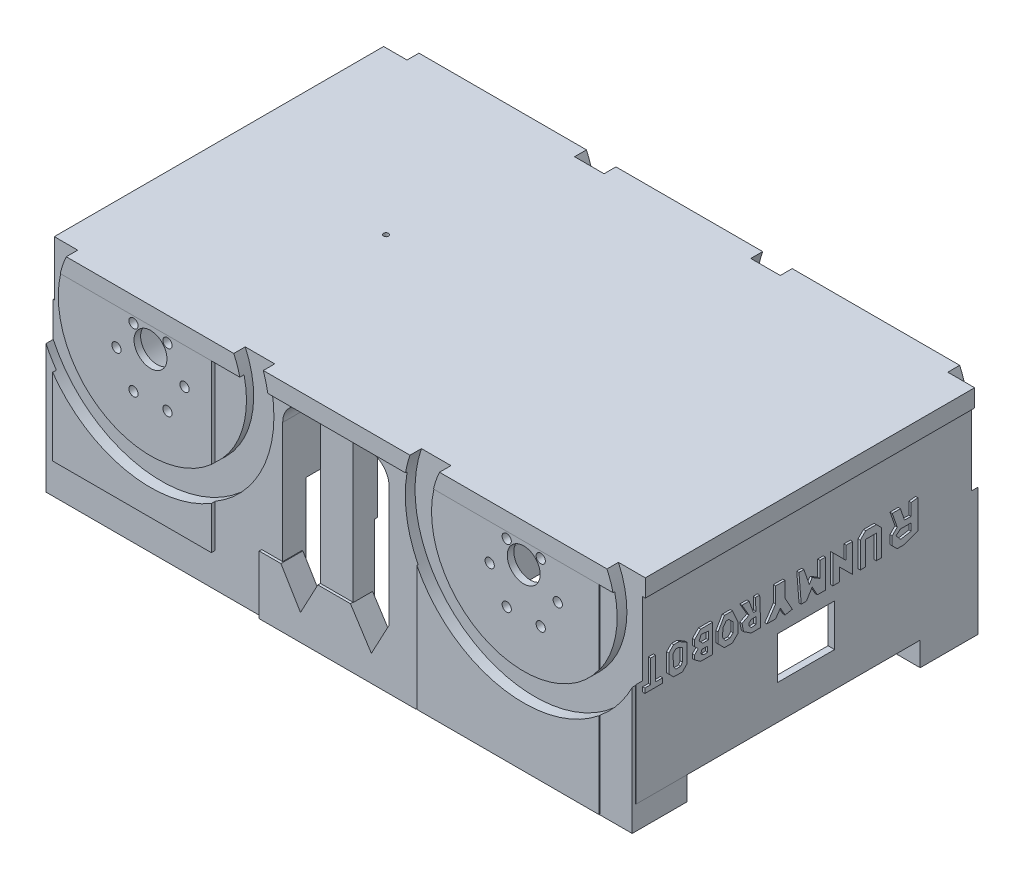
from build123d import *

# Parameters (mm, degrees)
MOTORHOLDERS_DEPTH            = 80
MOTORHOLDERS_DEPTH_BACK       = 80
MOTORHOLDERSSKETCH_R          = 23.41
MOTORHOLDERS_2_DEPTH          = 80
MOTORHOLDERS_2_DEPTH_BACK     = 80
SKETCH4_W                     = 262.774983374
SKETCH4_H                     = 153.112553215
CUT_EXTRUDE1_DEPTH            = 26
POWERBANKHOLDERS_DEPTH        = 40
POWERBANKHOLDERS_DEPTH_BACK   = 59
SKETCH6_W                     = 107.485666349
SKETCH6_H                     = 13.420779118
SKETCH6_W_2                   = 20.810206851
SKETCH6_H_2                   = 2.021058642
POWERBANKHOLDERS_2_DEPTH      = 40
POWERBANKHOLDERS_2_DEPTH_BACK = 59
SKETCH6_W_3                   = 107.81575089
SKETCH6_H_3                   = 38.261259506
SKETCH6_W_4                   = 10.842850571
SKETCH6_H_4                   = 10.347679347
POWERBANKHOLDERS_3_DEPTH      = 40
POWERBANKHOLDERS_3_DEPTH_BACK = 59
SKETCH6_W_5                   = 41.498763714
SKETCH6_H_5                   = 37.111507406
SKETCH6_W_6                   = 12.844328805
SKETCH6_H_6                   = 18.336479725
SKETCH6_W_7                   = 4.801433035
SKETCH6_H_7                   = 16.443461188
POWERBANKHOLDERS_4_DEPTH      = 40
POWERBANKHOLDERS_4_DEPTH_BACK = 59
SKETCH6_W_8                   = 41.763104176
SKETCH6_H_8                   = 35.272094794
SKETCH6_W_9                   = 11.134493861
SKETCH6_H_9                   = 18.035399163
SKETCH6_W_10                  = 4.654088682
SKETCH6_H_10                  = 14.436538778
POWERBANKHOLDERS_5_DEPTH      = 40
POWERBANKHOLDERS_5_DEPTH_BACK = 59
SKETCH6_W_11                  = 17.763333386
SKETCH6_H_11                  = 11.185766025
POWERBANKHOLDERS_6_DEPTH      = 40
POWERBANKHOLDERS_6_DEPTH_BACK = 59
SKETCH6_W_12                  = 14.811929009
SKETCH6_H_12                  = 11.030658464
POWERBANKHOLDERS_7_DEPTH      = 40
POWERBANKHOLDERS_7_DEPTH_BACK = 59
SKETCH6_W_13                  = 28.150495439
SKETCH6_H_13                  = 24.933985152
SKETCH6_W_14                  = 10.177859407
SKETCH6_H_14                  = 9.83070569
POWERBANKHOLDERS_8_DEPTH      = 40
POWERBANKHOLDERS_8_DEPTH_BACK = 59
SKETCH6_W_15                  = 30.670744753
SKETCH6_H_15                  = 26.330219561
SKETCH6_W_16                  = 9.898416255
SKETCH6_H_16                  = 10.635603546
BOTTOMPLATE_DEPTH             = 5
BOTTOMPLATE_DEPTH_BACK        = 3
SKETCH21_R                    = 156.395305675
SKETCH23_W                    = 72.331231332
SKETCH23_H                    = 81.163054316
SKETCH23_W_2                  = 82.936115801
SKETCH23_H_2                  = 96.211163908
MOTORMOUNTINGSUPPORT1_DEPTH   = 6
SKETCH24_W                    = 78.341994801
SKETCH24_H                    = 94.439711356
SKETCH24_W_2                  = 53.914675369
SKETCH24_H_2                  = 86.674739968
MOTORMOUNTINGSUPPOR2_DEPTH    = 6
SKETCH17_R                    = 2.1
SKETCH17_R_2                  = 7.5
MOTORHOLES1_DEPTH             = 31.5
SKETCH19_R                    = 2.1
SKETCH19_R_2                  = 7.5
CUT_EXTRUDE4_DEPTH            = 30
BOLTHOLESSKETCH3_R            = 2.1
BOLTHOLESSKETCH3_R_2          = 7.5
MOTORHOLES3_DEPTH             = 31.5
BOLTHOLESSKETCH4_R            = 2.1
BOLTHOLESSKETCH4_R_2          = 7.5
MOTORHOLES4_DEPTH             = 15
SKETCH29_W                    = 154.635205036
SKETCH29_H                    = 84.131588093
SKETCH29_W_2                  = 26
SKETCH29_H_2                  = 19.212652328
BOSS_EXTRUDE8_DEPTH           = 3
SKETCH27_W                    = 226.46009322
SKETCH27_H                    = 129.985211715
BOSS_EXTRUDE6_DEPTH           = 3
SKETCH40_W                    = 33.841577611
SKETCH40_H                    = 31.531825246
BOSS_EXTRUDE11_DEPTH          = 40
FILLET2_R                     = 15
FILLET3_R                     = 15
POWERBANKCUT_START            = -54.404272
POWERBANKCUT_DEPTH            = 54.404272
MOTORHOLDERCUT_DEPTH          = 77
MOTORHOLDERCUT_DEPTH_BACK     = 77
MOTORHOLDEREXTRUDESKETCH_R    = 20.415
LABEL_DEPTH                   = 1
BASEDEFININGCUT_DEPTH         = 20
BASEDEFININGCUT_DEPTH_BACK    = 20
SKETCH32_W                    = 420.045569038
SKETCH32_H                    = 425.046527557
SKETCH32_W_2                  = 269.205670794
SKETCH32_H_2                  = 160.645125556
SKETCH36_R                    = 7.790164171
CUT_EXTRUDE6_DEPTH            = 40
SKETCH37_W                    = 55.340133611
SKETCH37_H                    = 29.7708905
CUT_EXTRUDE7_DEPTH            = 36
SKETCH38_R                    = 1.145182774
CUT_EXTRUDE8_DEPTH            = 10
SPACEFORWHEEL1_DEPTH          = 10
SPACEFORWHEEL1_DEPTH_BACK     = 5
SKETCH41_R                    = 54.5
SKETCH41_R_2                  = 42
CUT_EXTRUDE10_DEPTH           = 10
CUT_EXTRUDE10_DEPTH_BACK      = 5
SKETCH42_R                    = 54.5
SKETCH42_R_2                  = 42
CUT_EXTRUDE11_DEPTH           = 10
CUT_EXTRUDE11_DEPTH_BACK      = 5
SKETCH43_R                    = 54.5
SKETCH43_R_2                  = 42
CUT_EXTRUDE12_DEPTH           = 10
CUT_EXTRUDE12_DEPTH_BACK      = 5
SKETCH44_R                    = 54.5
SKETCH44_R_2                  = 42
SKETCH45_W                    = 114.137539603
SKETCH45_H                    = 98.697181704
BACKPLATE_DEPTH               = 2
FILLET8_R                     = 10
FILLET9_R                     = 10
FILLET10_R                    = 10
FILLET11_R                    = 10
BOSS_EXTRUDE12_DEPTH          = 10
BOSS_EXTRUDE13_DEPTH          = 9


with BuildPart() as part:
    # MotorHoldersSketch → MotorHolders (new, two sides: drawn at the far end of the back side and taken through both)
    with BuildSketch(Plane.XY.offset(-MOTORHOLDERS_DEPTH_BACK)):
        Circle(MOTORHOLDERSSKETCH_R)
    extrude(amount=MOTORHOLDERS_DEPTH + MOTORHOLDERS_DEPTH_BACK)


with BuildPart() as body_2:
    # MotorHoldersSketch → MotorHolders 2 (new, two sides: drawn at the far end of the back side and taken through both)
    with BuildSketch(Plane.XY.offset(-MOTORHOLDERS_2_DEPTH_BACK)):
        with Locations((170, 0)):
            Circle(MOTORHOLDERSSKETCH_R)
    extrude(amount=MOTORHOLDERS_2_DEPTH + MOTORHOLDERS_2_DEPTH_BACK)


with BuildPart() as cut_extrude1_tool:
    # Sketch4 → Cut-Extrude1 (new body)
    with BuildSketch(Plane(origin=(0, 0, 0), x_dir=(1, 0, 0), z_dir=(0, 1, 0))):
        with Locations((89.893628689, 0.176832173)):
            Rectangle(SKETCH4_W, SKETCH4_H)
    extrude(amount=-CUT_EXTRUDE1_DEPTH)


with BuildPart() as part_1:
    add(part.part)

    # Cut-Extrude1: cut by cut_extrude1_tool
    add(cut_extrude1_tool.part, mode=Mode.SUBTRACT)


with BuildPart() as body_2_1:
    add(body_2.part)

    # Cut-Extrude1: cut by cut_extrude1_tool
    add(cut_extrude1_tool.part, mode=Mode.SUBTRACT)


with BuildPart() as body_3:
    # Sketch6 → PowerBankHolders (new, two sides: drawn at the far end of the back side and taken through both)
    with BuildSketch(Plane(origin=(170, -34.829272125, 0), x_dir=(-1, 0, 0), z_dir=(0, -1, 0)).offset(-POWERBANKHOLDERS_DEPTH_BACK)):
        with Locations((165.843013364, 72.238602394)):
            Rectangle(SKETCH6_W, SKETCH6_H)
        with Locations((203.359863582, 72.025840015)):
            Rectangle(SKETCH6_W_2, SKETCH6_H_2, mode=Mode.SUBTRACT)
    extrude(amount=POWERBANKHOLDERS_DEPTH + POWERBANKHOLDERS_DEPTH_BACK)



with BuildPart() as body_4:
    # Sketch6 → PowerBankHolders 2 (new, two sides: drawn at the far end of the back side and taken through both)
    with BuildSketch(Plane(origin=(170, -34.829272125, 0), x_dir=(-1, 0, 0), z_dir=(0, -1, 0)).offset(-POWERBANKHOLDERS_2_DEPTH_BACK)):
        with Locations((165.406852056, -59.151522269)):
            Rectangle(SKETCH6_W_3, SKETCH6_H_3)
        with Locations((206.519672379, -65.314281269)):
            Rectangle(SKETCH6_W_4, SKETCH6_H_4, mode=Mode.SUBTRACT)
    extrude(amount=POWERBANKHOLDERS_2_DEPTH + POWERBANKHOLDERS_2_DEPTH_BACK)


with BuildPart() as body_5:
    # Sketch6 → PowerBankHolders 3 (new, two sides: drawn at the far end of the back side and taken through both)
    with BuildSketch(Plane(origin=(170, -34.829272125, 0), x_dir=(-1, 0, 0), z_dir=(0, -1, 0)).offset(-POWERBANKHOLDERS_3_DEPTH_BACK)):
        with Locations((40.739743063, 59.306920349)):
            Rectangle(SKETCH6_W_5, SKETCH6_H_5)
        with Locations((34.93306737, 60.00949088)):
            Rectangle(SKETCH6_W_6, SKETCH6_H_6, mode=Mode.SUBTRACT)
        with Locations((56.270377412, 59.541495334)):
            Rectangle(SKETCH6_W_7, SKETCH6_H_7, mode=Mode.SUBTRACT)
    extrude(amount=POWERBANKHOLDERS_3_DEPTH + POWERBANKHOLDERS_3_DEPTH_BACK)


with BuildPart() as body_6:
    # Sketch6 → PowerBankHolders 4 (new, two sides: drawn at the far end of the back side and taken through both)
    with BuildSketch(Plane(origin=(170, -34.829272125, 0), x_dir=(-1, 0, 0), z_dir=(0, -1, 0)).offset(-POWERBANKHOLDERS_4_DEPTH_BACK)):
        with Locations((40.966801585, -61.807610384)):
            Rectangle(SKETCH6_W_8, SKETCH6_H_8)
        with Locations((37.73953158, -63.792391966)):
            Rectangle(SKETCH6_W_9, SKETCH6_H_9, mode=Mode.SUBTRACT)
        with Locations((54.037759341, -62.645522509)):
            Rectangle(SKETCH6_W_10, SKETCH6_H_10, mode=Mode.SUBTRACT)
    extrude(amount=POWERBANKHOLDERS_4_DEPTH + POWERBANKHOLDERS_4_DEPTH_BACK)


with BuildPart() as body_7:
    # Sketch6 → PowerBankHolders 5 (new, two sides: drawn at the far end of the back side and taken through both)
    with BuildSketch(Plane(origin=(170, -34.829272125, 0), x_dir=(-1, 0, 0), z_dir=(0, -1, 0)).offset(-POWERBANKHOLDERS_5_DEPTH_BACK)):
        with Locations((88.297855443, 73.356108941)):
            Rectangle(SKETCH6_W_11, SKETCH6_H_11)
    extrude(amount=POWERBANKHOLDERS_5_DEPTH + POWERBANKHOLDERS_5_DEPTH_BACK)


with BuildPart() as body_8:
    # Sketch6 → PowerBankHolders 6 (new, two sides: drawn at the far end of the back side and taken through both)
    with BuildSketch(Plane(origin=(170, -34.829272125, 0), x_dir=(-1, 0, 0), z_dir=(0, -1, 0)).offset(-POWERBANKHOLDERS_6_DEPTH_BACK)):
        with Locations((86.822153254, -72.76682279)):
            Rectangle(SKETCH6_W_12, SKETCH6_H_12)
    extrude(amount=POWERBANKHOLDERS_6_DEPTH + POWERBANKHOLDERS_6_DEPTH_BACK)


with BuildPart() as body_9:
    # Sketch6 → PowerBankHolders 7 (new, two sides: drawn at the far end of the back side and taken through both)
    with BuildSketch(Plane(origin=(170, -34.829272125, 0), x_dir=(-1, 0, 0), z_dir=(0, -1, 0)).offset(-POWERBANKHOLDERS_7_DEPTH_BACK)):
        with Locations((-34.775388772, -66.976665205)):
            Rectangle(SKETCH6_W_13, SKETCH6_H_13)
        with Locations((-36.725173705, -67.894738702)):
            Rectangle(SKETCH6_W_14, SKETCH6_H_14, mode=Mode.SUBTRACT)
    extrude(amount=POWERBANKHOLDERS_7_DEPTH + POWERBANKHOLDERS_7_DEPTH_BACK)


with BuildPart() as body_10:
    # Sketch6 → PowerBankHolders 8 (new, two sides: drawn at the far end of the back side and taken through both)
    with BuildSketch(Plane(origin=(170, -34.829272125, 0), x_dir=(-1, 0, 0), z_dir=(0, -1, 0)).offset(-POWERBANKHOLDERS_8_DEPTH_BACK)):
        with Locations((-33.722690809, 64.697564271)):
            Rectangle(SKETCH6_W_15, SKETCH6_H_15)
        with Locations((-36.585452129, 63.859928969)):
            Rectangle(SKETCH6_W_16, SKETCH6_H_16, mode=Mode.SUBTRACT)
    extrude(amount=POWERBANKHOLDERS_8_DEPTH + POWERBANKHOLDERS_8_DEPTH_BACK)


with BuildPart() as body_3_1:
    add(body_3.part)

    add(body_4.part)  # BottomPlate merges body 4

    add(body_2_1.part)  # BottomPlate merges body 2

    add(part_1.part)  # BottomPlate merges part

    add(body_5.part)  # BottomPlate merges body 5

    add(body_6.part)  # BottomPlate merges body 6
    # Sketch21 → BottomPlate (add, two sides: drawn at the far end of the back side and taken through both)
    with BuildSketch(Plane(origin=(0, 19.575, 0), x_dir=(1, 0, 0), z_dir=(0, 1, 0)).offset(-BOTTOMPLATE_DEPTH_BACK)):
        with Locations(Location((85, 0, 0), (0, 0, 270))):
            Circle(SKETCH21_R)
    extrude(amount=BOTTOMPLATE_DEPTH + BOTTOMPLATE_DEPTH_BACK)


    add(body_9.part)  # MotorMountingSupport1 merges body 9
    # Sketch23 → MotorMountingSupport1 (add)
    with BuildSketch(Plane.XY.offset(80)):
        with Locations((-8.424510745, -18.741332274)):
            Rectangle(SKETCH23_W, SKETCH23_H)
        with Locations((162.789906406, -26.26538707)):
            Rectangle(SKETCH23_W_2, SKETCH23_H_2)
    extrude(amount=-MOTORMOUNTINGSUPPORT1_DEPTH)


    add(body_10.part)  # MotorMountingSuppor2 merges body 10
    # Sketch24 → MotorMountingSuppor2 (add)
    with BuildSketch(Plane(origin=(0, 0, -80), x_dir=(-1, 0, 0), z_dir=(0, 0, -1))):
        with Locations((-163.019522912, -27.982448794)):
            Rectangle(SKETCH24_W, SKETCH24_H)
        with Locations((2.593149567, -20.814772641)):
            Rectangle(SKETCH24_W_2, SKETCH24_H_2)
    extrude(amount=-MOTORMOUNTINGSUPPOR2_DEPTH)

    # Sketch17 → MotorHoles1 (cut)
    with BuildSketch(Plane.XY.offset(80)):
        with Locations((185.5, 0)):
            Circle(SKETCH17_R)
        with Locations((177.75, -13.42)):
            Circle(SKETCH17_R)
        with Locations((162.25, -13.42)):
            Circle(SKETCH17_R)
        with Locations((154.5, 0)):
            Circle(SKETCH17_R)
        with Locations((162.25, 13.42)):
            Circle(SKETCH17_R)
        with Locations((177.75, 13.42)):
            Circle(SKETCH17_R)
        with Locations((170, 7)):
            Circle(SKETCH17_R_2)
    extrude(amount=-MOTORHOLES1_DEPTH, mode=Mode.SUBTRACT)

    # Sketch19 → Cut-Extrude4 (cut)
    with BuildSketch(Plane(origin=(0, 0, -80), x_dir=(-1, 0, 0), z_dir=(0, 0, -1))):
        with Locations(Location((-185.5, 0, 0), (0, 0, 180))):
            Circle(SKETCH19_R)
        with Locations(Location((-177.75, -13.42, 0), (0, 0, 180))):
            Circle(SKETCH19_R)
        with Locations(Location((-162.25, -13.42, 0), (0, 0, 180))):
            Circle(SKETCH19_R)
        with Locations(Location((-154.5, 0, 0), (0, 0, 180))):
            Circle(SKETCH19_R)
        with Locations(Location((-162.25, 13.42, 0), (0, 0, 180))):
            Circle(SKETCH19_R)
        with Locations(Location((-177.75, 13.42, 0), (0, 0, 180))):
            Circle(SKETCH19_R)
        with Locations(Location((-170, 7, 0), (0, 0, 180))):
            Circle(SKETCH19_R_2)
    extrude(amount=-CUT_EXTRUDE4_DEPTH, mode=Mode.SUBTRACT)

    # BoltHolesSketch3 → MotorHoles3 (cut)
    with BuildSketch(Plane.XY.offset(80)):
        with Locations((7.75, -13.42)):
            Circle(BOLTHOLESSKETCH3_R)
        with Locations((15.5, 0)):
            Circle(BOLTHOLESSKETCH3_R)
        with Locations((7.75, 13.42)):
            Circle(BOLTHOLESSKETCH3_R)
        with Locations((-7.75, 13.42)):
            Circle(BOLTHOLESSKETCH3_R)
        with Locations((-15.5, 0)):
            Circle(BOLTHOLESSKETCH3_R)
        with Locations((-7.75, -13.42)):
            Circle(BOLTHOLESSKETCH3_R)
        with Locations((0, 7)):
            Circle(BOLTHOLESSKETCH3_R_2)
    extrude(amount=-MOTORHOLES3_DEPTH, mode=Mode.SUBTRACT)

    # BoltHolesSketch4 → MotorHoles4 (cut)
    with BuildSketch(Plane(origin=(0, 0, -80), x_dir=(-1, 0, 0), z_dir=(0, 0, -1))):
        with Locations(Location((-15.5, 0, 0), (0, 0, 180))):
            Circle(BOLTHOLESSKETCH4_R)
        with Locations(Location((-7.75, 13.42, 0), (0, 0, 180))):
            Circle(BOLTHOLESSKETCH4_R)
        with Locations(Location((7.75, 13.42, 0), (0, 0, 180))):
            Circle(BOLTHOLESSKETCH4_R)
        with Locations(Location((15.5, 0, 0), (0, 0, 180))):
            Circle(BOLTHOLESSKETCH4_R)
        with Locations(Location((7.75, -13.42, 0), (0, 0, 180))):
            Circle(BOLTHOLESSKETCH4_R)
        with Locations(Location((-7.75, -13.42, 0), (0, 0, 180))):
            Circle(BOLTHOLESSKETCH4_R)
        with Locations(Location((0, 7, 0), (0, 0, 180))):
            Circle(BOLTHOLESSKETCH4_R_2)
    extrude(amount=-MOTORHOLES4_DEPTH, mode=Mode.SUBTRACT)

    # Sketch29 → Boss-Extrude8 (add)
    with BuildSketch(Plane(origin=(219.058063185, 0, 0), x_dir=(0, 0, -1), z_dir=(1, 0, 0))):
        with Locations((-0.622085312, -21.859578752)):
            Rectangle(SKETCH29_W, SKETCH29_H)
        with Locations((-0.45071267, -38.546737855)):
            Rectangle(SKETCH29_W_2, SKETCH29_H_2, mode=Mode.SUBTRACT)
    extrude(amount=-BOSS_EXTRUDE8_DEPTH)

    # Sketch27 → Boss-Extrude6 (add)
    with BuildSketch(Plane(origin=(0, 16.575, 0), x_dir=(-1, 0, 0), z_dir=(0, -1, 0))):
        with Locations((-81.596376522, -0.440920076)):
            Rectangle(SKETCH27_W, SKETCH27_H)
    extrude(amount=-BOSS_EXTRUDE6_DEPTH)

    # Sketch40 → Boss-Extrude11 (add)
    with BuildSketch(Plane.XZ.offset(-16.575)):
        with Locations((-32.665057733, -49.762300212)):
            Rectangle(SKETCH40_W, SKETCH40_H)
    extrude(amount=BOSS_EXTRUDE11_DEPTH)

    # Fillet2
    fillet2_edges = [body_3_1.edges().sort_by_distance(p)[0] for p in [
        (-33.058778866, 16.575, -33.996387589),
    ]]
    fillet(fillet2_edges, radius=FILLET2_R)

    # Fillet3
    fillet3_edges = [body_3_1.edges().sort_by_distance(p)[0] for p in [
        (-32.665057733, -23.425, -65.528212835),
    ]]
    fillet(fillet3_edges, radius=FILLET3_R)


with BuildPart() as powerbankcut_tool:
    # Sketch11 → PowerBankCut (new body)
    with BuildSketch(Plane(origin=(0, -20.425, 0), x_dir=(1, 0, 0), z_dir=(0, 1, 0)).offset(POWERBANKCUT_START)):
        Polygon((-34.216190018, -64.758061011), (-34.216190018, 73.342459946), (204.216190018, 63.61100878), (204.216190018, -72.195407715), align=None)
    extrude(amount=POWERBANKCUT_DEPTH)


with BuildPart() as body_3_2:
    add(body_3_1.part)

    # PowerBankCut: cut by powerbankcut_tool
    add(powerbankcut_tool.part, mode=Mode.SUBTRACT)

    # MotorHolderExtrudeSketch → MotorHolderCut (cut, two sides: drawn at the far end of the back side and taken through both)
    with BuildSketch(Plane.XY.offset(-MOTORHOLDERCUT_DEPTH_BACK)):
        with Locations((170, 0)):
            Circle(MOTORHOLDEREXTRUDESKETCH_R)
        Circle(MOTORHOLDEREXTRUDESKETCH_R)
    extrude(amount=MOTORHOLDERCUT_DEPTH + MOTORHOLDERCUT_DEPTH_BACK, mode=Mode.SUBTRACT)

    # Sketch31 → Label (add)
    # profile 1 of 10: a face of its own
    with BuildSketch(Plane(origin=(219.058063185, 0, 0), x_dir=(0, 0, -1), z_dir=(1, 0, 0))):
        Polygon((49.44174371, -6.192727454), (49.44174371, -19.373871934), (42.934240846, -21.634082149), (40.061775134, -21.634082149), (37.786330287, -19.358637302), (37.786330287, -15.381348839), (40.061775134, -13.105903993), (37.786330287, -6.554538213), (41.49800799, -6.554538213), (43.400438848, -12.031937694), (46.389004897, -12.031937694), (46.389004897, -6.554538213), align=None)
        Polygon((46.389004897, -17.885685432), (46.389004897, -14.591500132), (41.49800799, -14.591500132), (39.506689527, -16.25408163), (41.565563867, -18.720050661), align=None, mode=Mode.SUBTRACT)
    # profile 2 of 10: a face of its own
    with BuildSketch(Plane(origin=(219.058063185, 0, 0), x_dir=(0, 0, -1), z_dir=(1, 0, 0))):
        Polygon((33.019279212, -21.634082149), (33.019279212, -9.830221103), (30.540166598, -7.351108489), (25.720297263, -7.351108489), (23.241184649, -9.830221103), (23.241184649, -21.634082149), (25.720297263, -21.634082149), (25.720297263, -10.745357897), (30.540166598, -10.745357897), (30.540166598, -21.634082149), align=None)
    # profile 3 of 10: a face of its own
    with BuildSketch(Plane(origin=(219.058063185, 0, 0), x_dir=(0, 0, -1), z_dir=(1, 0, 0))):
        Polygon((19.722613698, -8.590664796), (19.722613698, -21.634082149), (13.820683175, -15.732151626), (13.820683175, -21.634082149), (10.7708131, -21.634082149), (10.7708131, -8.590664796), (16.771648437, -14.591500132), (16.771648437, -8.590664796), align=None)
    # profile 4 of 10: a face of its own
    with BuildSketch(Plane(origin=(219.058063185, 0, 0), x_dir=(0, 0, -1), z_dir=(1, 0, 0))):
        Polygon((7.38910922, -8.590664796), (7.38910922, -21.634082149), (3.728231084, -21.634082149), (1.320922213, -17.369993071), (-1.251934103, -21.634082149), (-3.655389162, -21.634082149), (-4.691643117, -8.590664796), (-2.453661633, -8.590664796), (0.034494055, -15.754458747), (1.320922213, -13.622414208), (4.854437776, -15.754458747), (4.854437776, -8.590664796), align=None)
    # profile 5 of 10: a face of its own
    with BuildSketch(Plane(origin=(219.058063185, 0, 0), x_dir=(0, 0, -1), z_dir=(1, 0, 0))):
        Polygon((-7.682306608, -21.634082149), (-10.987514091, -15.754458747), (-10.987514091, -8.590664796), (-15.310206688, -8.590664796), (-15.310206688, -15.754458747), (-19.269516545, -21.634082149), (-15.310206688, -21.634082149), (-13.148860389, -18.424456549), (-10.987514091, -22.269268816), align=None)
    # profile 6 of 10: a face of its own
    with BuildSketch(Plane(origin=(219.058063185, 0, 0), x_dir=(0, 0, -1), z_dir=(1, 0, 0))):
        Polygon((-22.571010896, -8.590664796), (-22.098919416, -21.634082149), (-26.491509787, -21.634082149), (-29.911637517, -19.358637302), (-30.635996911, -15.754458747), (-27.413487689, -14.105212159), (-30.635996911, -8.590664796), (-27.413487689, -8.590664796), (-25.398720895, -14.105212159), (-24.295214602, -14.105212159), (-24.494807297, -8.590664796), align=None)
        Polygon((-24.295214602, -19.358637302), (-24.295214602, -16.25408163), (-26.491509787, -16.25408163), (-27.413487689, -17.176059532), (-27.413487689, -18.424456549), (-26.333852082, -19.504092156), align=None, mode=Mode.SUBTRACT)
    # profile 7 of 10: a face of its own
    with BuildSketch(Plane(origin=(219.058063185, 0, 0), x_dir=(0, 0, -1), z_dir=(1, 0, 0))):
        Polygon((-35.009913233, -8.590664796), (-38.639456152, -8.590664796), (-41.524071596, -13.622414208), (-41.524071596, -18.424456549), (-38.639456152, -21.309071994), (-35.009913233, -21.309071994), (-32.497839278, -18.796998039), (-32.497839278, -14.105212159), align=None)
        Polygon((-36.111415057, -18.796998039), (-34.718122355, -17.403705336), (-34.718122355, -13.105903993), (-36.662704643, -11.161321704), (-37.865915536, -11.161321704), (-39.310718257, -13.105903993), (-39.515454652, -16.854377093), (-38.250007481, -18.720050661), align=None, mode=Mode.SUBTRACT)
    # profile 8 of 10: a face of its own
    with BuildSketch(Plane(origin=(219.058063185, 0, 0), x_dir=(0, 0, -1), z_dir=(1, 0, 0))):
        Polygon((-44.059291997, -21.309071994), (-44.059291997, -8.590664796), (-49.449943726, -8.590664796), (-52.226947095, -11.367668165), (-52.226947095, -14.105212159), (-50.577700506, -15.754458747), (-52.226947095, -17.403705336), (-52.226947095, -19.358637302), (-49.449943726, -21.309071994), align=None)
        Polygon((-46.243610757, -16.854377093), (-48.903166093, -16.854377093), (-49.449943726, -18.424456549), (-48.083567545, -19.358637302), (-46.243610757, -19.358637302), align=None, mode=Mode.SUBTRACT)
        Polygon((-45.920604156, -14.591500132), (-45.920604156, -11.161321704), (-49.210466936, -10.745357897), (-50.175617033, -12.876410918), (-48.58914421, -14.591500132), align=None, mode=Mode.SUBTRACT)
    # profile 9 of 10: a face of its own
    with BuildSketch(Plane(origin=(219.058063185, 0, 0), x_dir=(0, 0, -1), z_dir=(1, 0, 0))):
        Polygon((-57.797660681, -21.309071994), (-55.60105832, -19.112469633), (-55.60105832, -10.745357897), (-59.263729006, -8.590664796), (-61.781771114, -8.590664796), (-63.936464214, -10.745357897), (-63.936464214, -19.112469633), (-61.781771114, -21.267162733), align=None)
        Polygon((-58.567152612, -18.720050661), (-57.797660681, -17.403705336), (-57.797660681, -11.763595566), (-59.657270857, -10.745357897), (-60.814447819, -10.745357897), (-62.101027616, -12.031937694), (-61.781771114, -17.403705336), (-60.814447819, -18.720050661), align=None, mode=Mode.SUBTRACT)
    # profile 10 of 10: a face of its own
    with BuildSketch(Plane(origin=(219.058063185, 0, 0), x_dir=(0, 0, -1), z_dir=(1, 0, 0))):
        Polygon((-66.791767957, -21.267162733), (-74.870531799, -21.267162733), (-74.870531799, -19.112469633), (-72.266477292, -19.112469633), (-72.266477292, -8.590664796), (-69.997684236, -8.590664796), (-69.997684236, -19.112469633), (-66.791767957, -19.112469633), align=None)
    extrude(amount=LABEL_DEPTH)

    # Sketch32 → BaseDefiningCut (cut, two sides: drawn at the far end of the back side and taken through both)
    with BuildSketch(Plane(origin=(0, 19.575, 0), x_dir=(1, 0, 0), z_dir=(0, 1, 0)).offset(-BASEDEFININGCUT_DEPTH_BACK)):
        with Locations((73.53385004, -6.203492346)):
            Rectangle(SKETCH32_W, SKETCH32_H)
        with Locations((85.789158114, 0.107563087)):
            Rectangle(SKETCH32_W_2, SKETCH32_H_2, mode=Mode.SUBTRACT)
    extrude(amount=BASEDEFININGCUT_DEPTH + BASEDEFININGCUT_DEPTH_BACK, mode=Mode.SUBTRACT)

    # Sketch36 → Cut-Extrude6 (cut)
    with BuildSketch(Plane.ZY.offset(49.314727501)):
        with Locations((49.382152022, -38.368879339)):
            Circle(SKETCH36_R)
    extrude(amount=-CUT_EXTRUDE6_DEPTH, mode=Mode.SUBTRACT)

    # Sketch37 → Cut-Extrude7 (cut)
    with BuildSketch(Plane.XZ.offset(20.425)):
        with Locations((116.745978541, -50.558354808)):
            Rectangle(SKETCH37_W, SKETCH37_H)
    extrude(amount=-CUT_EXTRUDE7_DEPTH, mode=Mode.SUBTRACT)

    # Sketch38 → Cut-Extrude8 (cut)
    with BuildSketch(Plane.XZ.offset(-16.575)):
        with Locations(Location((25.99644574, -1.316498015, 0), (0, 0, 270))):
            Circle(SKETCH38_R)
    extrude(amount=-CUT_EXTRUDE8_DEPTH, mode=Mode.SUBTRACT)

    # Sketch41 → SpaceForWheel1 (cut, two sides: drawn at the far end of the back side and taken through both)
    with BuildSketch(Plane.XY.offset(80).offset(-SPACEFORWHEEL1_DEPTH_BACK)):
        with Locations((0, 7)):
            Circle(SKETCH41_R)
        with Locations((0, 7)):
            Circle(SKETCH41_R_2, mode=Mode.SUBTRACT)
    extrude(amount=SPACEFORWHEEL1_DEPTH + SPACEFORWHEEL1_DEPTH_BACK, mode=Mode.SUBTRACT)

    # Sketch42 → Cut-Extrude10 (cut, two sides: drawn at the far end of the back side and taken through both)
    with BuildSketch(Plane.XY.offset(80).offset(-CUT_EXTRUDE10_DEPTH_BACK)):
        with Locations((170, 7)):
            Circle(SKETCH42_R)
        with Locations((170, 7)):
            Circle(SKETCH42_R_2, mode=Mode.SUBTRACT)
    extrude(amount=CUT_EXTRUDE10_DEPTH + CUT_EXTRUDE10_DEPTH_BACK, mode=Mode.SUBTRACT)

    # Sketch43 → Cut-Extrude11 (cut, two sides: drawn at the far end of the back side and taken through both)
    with BuildSketch(Plane(origin=(0, 0, -80), x_dir=(-1, 0, 0), z_dir=(0, 0, -1)).offset(-CUT_EXTRUDE11_DEPTH_BACK)):
        with Locations((-170, 7)):
            Circle(SKETCH43_R)
        with Locations((-170, 7)):
            Circle(SKETCH43_R_2, mode=Mode.SUBTRACT)
    extrude(amount=CUT_EXTRUDE11_DEPTH + CUT_EXTRUDE11_DEPTH_BACK, mode=Mode.SUBTRACT)

    # Sketch44 → Cut-Extrude12 (cut, two sides: drawn at the far end of the back side and taken through both)
    with BuildSketch(Plane(origin=(0, 0, -80), x_dir=(-1, 0, 0), z_dir=(0, 0, -1)).offset(-CUT_EXTRUDE12_DEPTH_BACK)):
        with Locations((0, 7)):
            Circle(SKETCH44_R)
        with Locations((0, 7)):
            Circle(SKETCH44_R_2, mode=Mode.SUBTRACT)
    extrude(amount=CUT_EXTRUDE12_DEPTH + CUT_EXTRUDE12_DEPTH_BACK, mode=Mode.SUBTRACT)

    # Sketch45 → BackPlate (add)
    with BuildSketch(Plane.ZY.offset(48.813677283)):
        with Locations((-15.037538426, -24.773590852)):
            Rectangle(SKETCH45_W, SKETCH45_H)
    extrude(amount=-BACKPLATE_DEPTH)

    # Fillet8
    fillet8_edges = [body_3_2.edges().sort_by_distance(p)[0] for p in [
        (57.89981981, 16.575, -72.238602394),
    ]]
    fillet(fillet8_edges, radius=FILLET8_R)

    # Fillet9
    # the kernel refuses this fillet: 10 mm, written as the material it adds along each edge
    with BuildSketch(Plane(origin=(108.51087508, 16.575, -77.862674052), x_dir=(0, -1, 0), z_dir=(0, 0, 1))) as fillet9_piece_1_section:
        with BuildLine():
            CenterArc((FILLET9_R, -FILLET9_R), FILLET9_R, 90, 90)
            Line((0, -FILLET9_R), (0, 0))
            Line((0, 0), (FILLET9_R, 0))
        make_face()
    fillet9_piece_1 = extrude(amount=37.111507406, mode=Mode.PRIVATE)
    fillet9_piece_1 = split(fillet9_piece_1, bisect_by=Plane(origin=(107.13497171, 15.575, -71.653237055), z_dir=(0, -1, 0)), keep=Keep.TOP, mode=Mode.PRIVATE)
    fillet9_piece_1 = split(fillet9_piece_1, bisect_by=Plane(origin=(107.13497171, 13.204405478, -65.443800058), z_dir=(0, 0, -1)), keep=Keep.TOP, mode=Mode.PRIVATE)
    add(fillet9_piece_1)
    with BuildSketch(Plane(origin=(108.51087508, 16.575, -77.862674052), x_dir=(0, -1, 0), z_dir=(0, 0, 1))) as fillet9_piece_2_section:
        with BuildLine():
            CenterArc((FILLET9_R, -FILLET9_R), FILLET9_R, 90, 90)
            Line((0, -FILLET9_R), (0, 0))
            Line((0, 0), (FILLET9_R, 0))
        make_face()
    fillet9_piece_2 = extrude(amount=37.111507406, mode=Mode.PRIVATE)
    fillet9_piece_2 = split(fillet9_piece_2, bisect_by=Plane(origin=(104.700954064, 15.575, -71.653237055), z_dir=(0, 1, 0)), keep=Keep.TOP, mode=Mode.PRIVATE)
    fillet9_piece_2 = split(fillet9_piece_2, bisect_by=Plane(origin=(104.700954064, 16.237563822, -65.443800058), z_dir=(0, 0, -1)), keep=Keep.TOP, mode=Mode.PRIVATE)
    add(fillet9_piece_2)
    with BuildSketch(Plane(origin=(108.51087508, 16.575, -77.862674052), x_dir=(0, -1, 0), z_dir=(0, 0, 1))) as fillet9_piece_3_section:
        with BuildLine():
            CenterArc((FILLET9_R, -FILLET9_R), FILLET9_R, 90, 90)
            Line((0, -FILLET9_R), (0, 0))
            Line((0, 0), (FILLET9_R, 0))
        make_face()
    fillet9_piece_3 = extrude(amount=37.111507406, mode=Mode.PRIVATE)
    fillet9_piece_3 = split(fillet9_piece_3, bisect_by=Plane(origin=(104.700954064, 15.575, -53.097483352), z_dir=(0, 1, 0)), keep=Keep.TOP, mode=Mode.PRIVATE)
    fillet9_piece_3 = split(fillet9_piece_3, bisect_by=Plane(origin=(104.700954064, 16.237563822, -65.443800058), z_dir=(0, 0, 1)), keep=Keep.TOP, mode=Mode.PRIVATE)
    add(fillet9_piece_3)

    # Fillet10
    fillet10_edges = [body_3_2.edges().sort_by_distance(p)[0] for p in [
        (108.151646327, 16.575, 61.807610384),
    ]]
    fillet(fillet10_edges, radius=FILLET10_R)

    # Fillet11
    fillet11_edges = [body_3_2.edges().sort_by_distance(p)[0] for p in [
        (58.501023389, 16.575, 59.151522269),
    ]]
    fillet(fillet11_edges, radius=FILLET11_R)



with BuildPart() as body_7_1:
    add(body_7.part)

    # PowerBankCut: cut by powerbankcut_tool
    add(powerbankcut_tool.part, mode=Mode.SUBTRACT)


with BuildPart() as body_8_1:
    add(body_8.part)

    # PowerBankCut: cut by powerbankcut_tool
    add(powerbankcut_tool.part, mode=Mode.SUBTRACT)


with BuildPart() as body_3_3:
    add(body_3_2.part)

    add(body_8_1.part)  # Boss-Extrude12 merges body 8
    # Sketch51 → Boss-Extrude12 (add)
    with BuildSketch(Plane.XY.offset(79.443657781)):
        Polygon((108.151646327, -47.98038528), (100.046955512, -63.179220835), (90.516348019, -48.336772286), (75.676177949, -48.336772286), (67.761528435, -63.179220835), (58.839832918, -48.336772286), (48.929052362, -48.336772286), (48.929052362, -75.040734929), (120.251371925, -75.040734929), (120.251371925, -47.98038528), align=None)
    extrude(amount=-BOSS_EXTRUDE12_DEPTH)


    add(body_7_1.part)  # Boss-Extrude13 merges body 7
    # Sketch53 → Boss-Extrude13 (add)
    with BuildSketch(Plane(origin=(0, 0, -77.862674052), x_dir=(-1, 0, 0), z_dir=(0, 0, -1))):
        Polygon((-57.799247354, -55.761623835), (-64.666800666, -65.107182533), (-72.754062458, -55.761623835), (-90.655375706, -55.761623835), (-98.668066194, -65.107182533), (-108.51087508, -55.761623835), (-123.848525511, -55.761623835), (-123.848525511, -74.829272125), (-52.438264255, -74.829272125), (-52.438264255, -55.761623835), align=None)
    extrude(amount=-BOSS_EXTRUDE13_DEPTH)


solid = body_3_3.part
